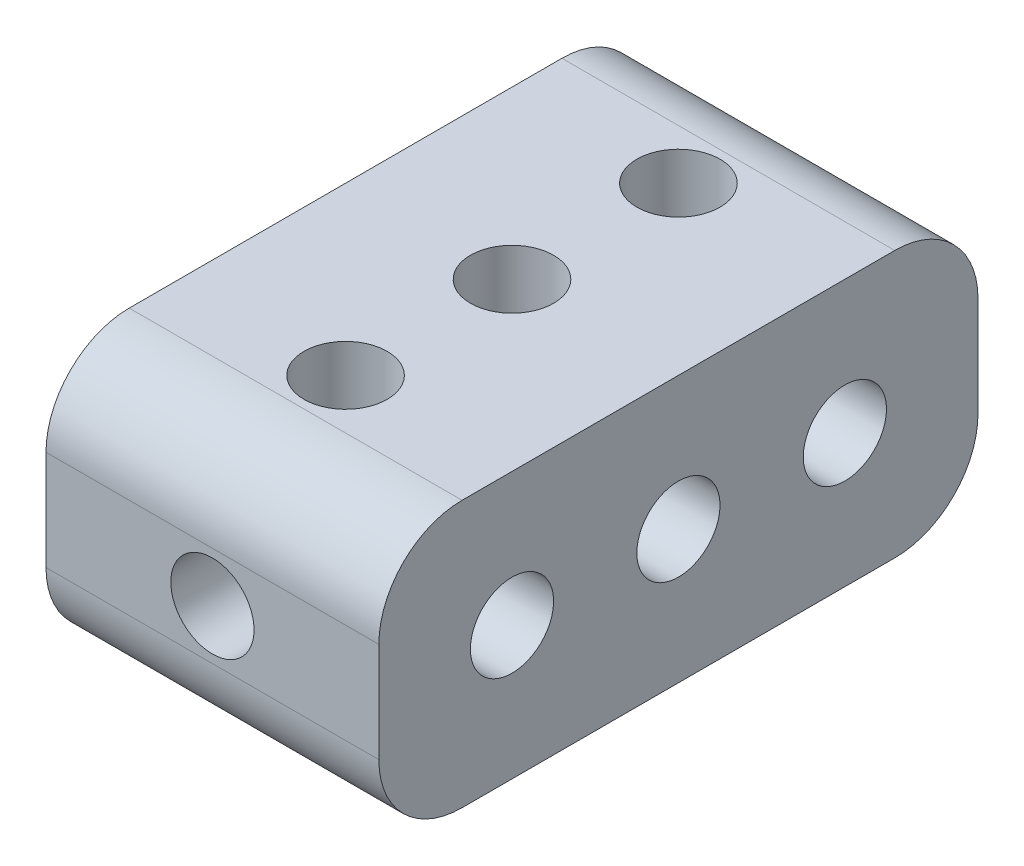
from build123d import *

# Parameters (mm, degrees)
SKETCH1_W           = 25.4
SKETCH1_H           = 45.72
BOSS_EXTRUDE1_DEPTH = 20.32
FILLET1_R           = 6.35
SKETCH2_R           = 3.175
CUT_EXTRUDE1_DEPTH  = 34.117548218
SKETCH3_R           = 3.175
CUT_EXTRUDE2_DEPTH  = 40.75728864
SKETCH4_R           = 3.175
CUT_EXTRUDE3_DEPTH  = 52.61889964


with BuildPart() as part:
    # Sketch1 → Boss-Extrude1 (new body)
    with BuildSketch(Plane(origin=(0, 0, 0), x_dir=(1, 0, 0), z_dir=(0, 1, 0))):
        Rectangle(SKETCH1_W, SKETCH1_H)
    extrude(amount=BOSS_EXTRUDE1_DEPTH)

    # Fillet1
    fillet1_edges = [part.edges().sort_by_distance(p)[0] for p in [
        (0, 0, -22.86),
        (0, 20.32, -22.86),
        (0, 0, 22.86),
        (0, 20.32, 22.86),
    ]]
    fillet(fillet1_edges, radius=FILLET1_R)

    # Sketch2 → Cut-Extrude1 (cut, through all)
    with BuildSketch(Plane(origin=(0, 20.32, 0), x_dir=(1, 0, 0), z_dir=(0, 1, 0))):
        with Locations((0, 12.7)):
            Circle(SKETCH2_R)
        Circle(SKETCH2_R)
        with Locations((0, -12.7)):
            Circle(SKETCH2_R)
    extrude(amount=-CUT_EXTRUDE1_DEPTH, mode=Mode.SUBTRACT)

    # Sketch3 → Cut-Extrude2 (cut, through all)
    with BuildSketch(Plane.ZY.offset(12.7)):
        with Locations((-12.7, 10.16)):
            Circle(SKETCH3_R)
        with Locations((0, 10.16)):
            Circle(SKETCH3_R)
        with Locations((12.7, 10.16)):
            Circle(SKETCH3_R)
    extrude(amount=-CUT_EXTRUDE2_DEPTH, mode=Mode.SUBTRACT)

    # Sketch4 → Cut-Extrude3 (cut, through all)
    with BuildSketch(Plane.XY.offset(22.86)):
        with Locations((0, 10.16)):
            Circle(SKETCH4_R)
    extrude(amount=-CUT_EXTRUDE3_DEPTH, mode=Mode.SUBTRACT)


solid = part.part
